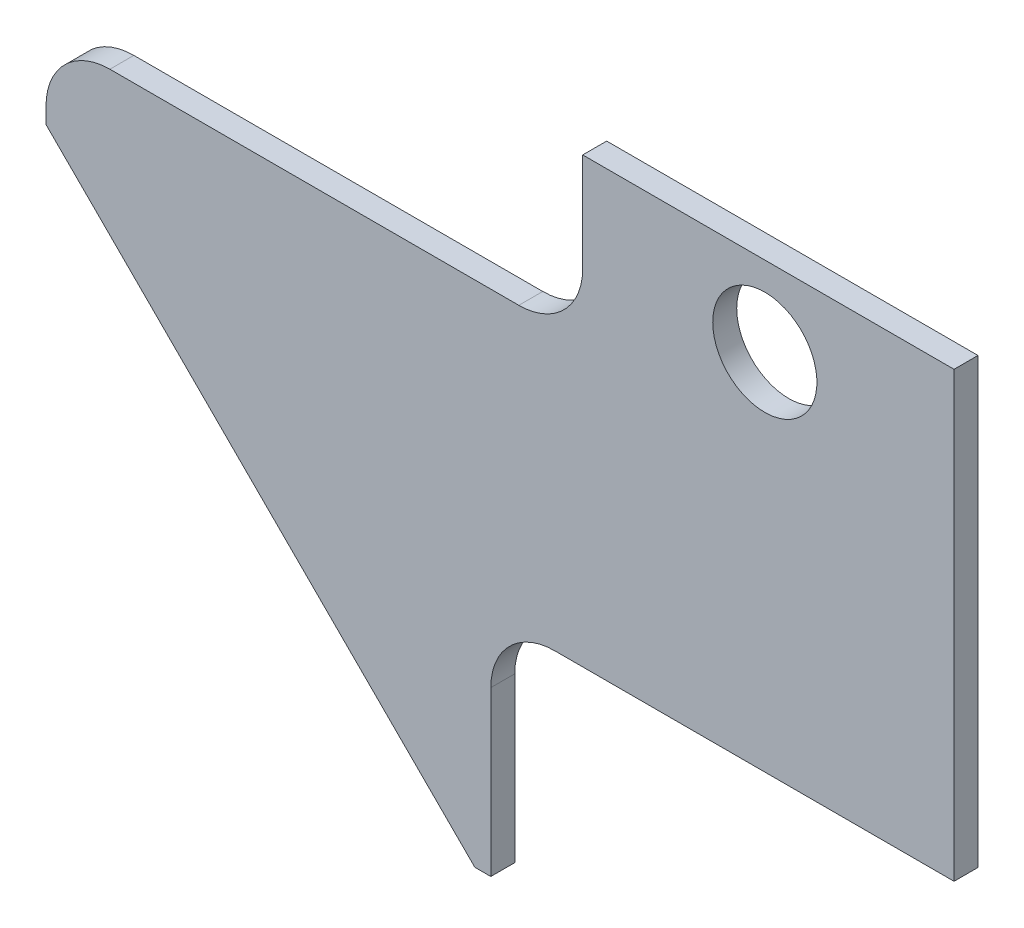
from build123d import *

# Parameters (mm, degrees)
SKETCH1_R           = 20.701
BOSS_EXTRUDE1_DEPTH = 9.525
SKETCH2_W           = 184.15
SKETCH2_H           = 90.42146
CUT_EXTRUDE1_DEPTH  = 267.045158533
FILLET1_R           = 25.4
SKETCH4_W           = 213.36
SKETCH4_H           = 64.479988722
CUT_EXTRUDE2_DEPTH  = 267.045158533
FILLET2_R           = 25.4


with BuildPart() as part:
    # Sketch1 → Boss-Extrude1 (new body)
    with BuildSketch(Plane.XY):
        Polygon((-138.259383474, 48.991487021), (32.210627804, -121.478524257), (222.710627804, -121.478524257), (222.710627804, 145.221475743), (-138.259383474, 145.221475743), align=None)
        with Locations((147.490616526, 113.471475743)):
            Circle(SKETCH1_R, mode=Mode.SUBTRACT)
    extrude(amount=BOSS_EXTRUDE1_DEPTH)

    # Sketch2 → Cut-Extrude1 (cut, through all)
    with BuildSketch(Plane.XY.offset(9.525)):
        with Locations((130.635627804, -76.267794257)):
            Rectangle(SKETCH2_W, SKETCH2_H)
    extrude(amount=-CUT_EXTRUDE1_DEPTH, mode=Mode.SUBTRACT)

    # Fillet1
    fillet1_edges = [part.edges().sort_by_distance(p)[0] for p in [
        (38.560627804, -31.057064257, 4.7625),
    ]]
    fillet(fillet1_edges, radius=FILLET1_R)

    # Sketch4 → Cut-Extrude2 (cut, through all)
    with BuildSketch(Plane.XY.offset(9.525)):
        with Locations((-31.579383474, 112.981481382)):
            Rectangle(SKETCH4_W, SKETCH4_H)
    extrude(amount=-CUT_EXTRUDE2_DEPTH, mode=Mode.SUBTRACT)

    # Fillet2
    fillet2_edges = [part.edges().sort_by_distance(p)[0] for p in [
        (-138.259383474, 80.741487021, 4.7625),
        (75.100616526, 80.741487021, 4.7625),
    ]]
    fillet(fillet2_edges, radius=FILLET2_R)


solid = part.part
